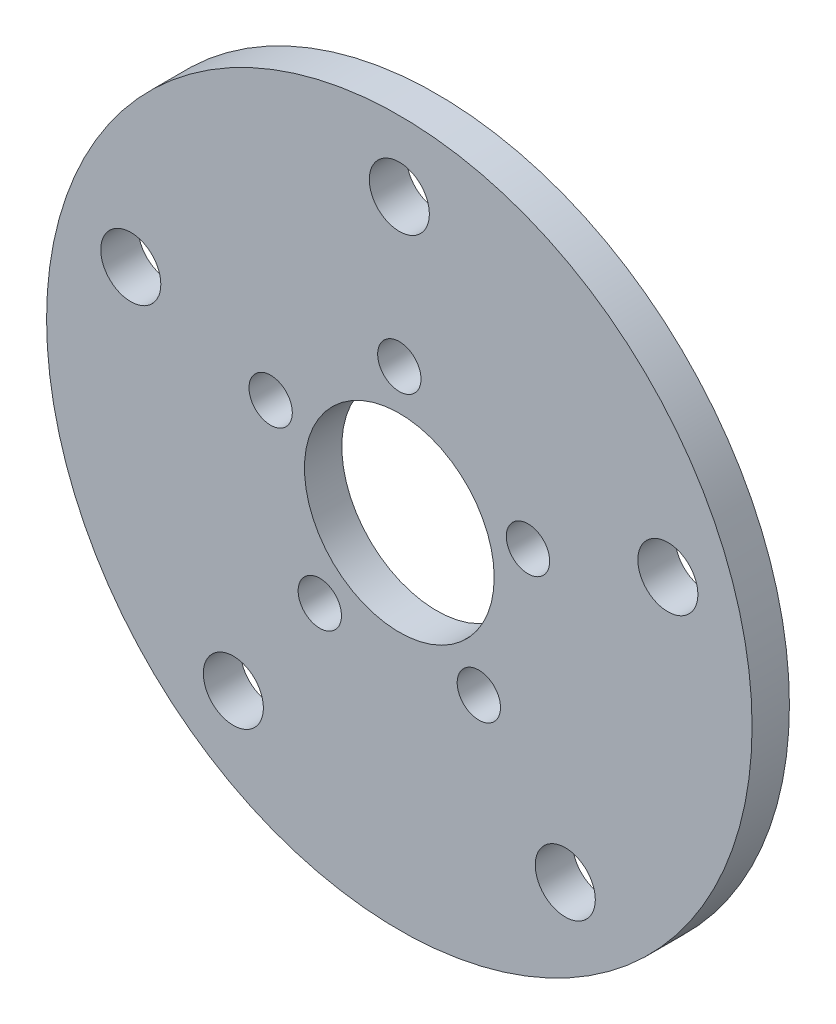
from build123d import *

# Parameters (mm, degrees)
SKETCH1_R           = 29.9847
SKETCH1_R_2         = 8.0645
SKETCH1_R_3         = 1.8415
SKETCH1_R_4         = 2.5527
BOSS_EXTRUDE1_DEPTH = 3.175


with BuildPart() as part:
    # Sketch1 → Boss-Extrude1 (new body)
    with BuildSketch(Plane.XY):
        Circle(SKETCH1_R)
        Circle(SKETCH1_R_2, mode=Mode.SUBTRACT)
        with Locations((0, 11.5)):
            Circle(SKETCH1_R_3, mode=Mode.SUBTRACT)
        with Locations((0, 24.000000006)):
            Circle(SKETCH1_R_4, mode=Mode.SUBTRACT)
        with Locations((10.937149937, 3.553695435)):
            Circle(SKETCH1_R_3, mode=Mode.SUBTRACT)
        with Locations((22.825356397, 7.416407867)):
            Circle(SKETCH1_R_4, mode=Mode.SUBTRACT)
        with Locations((6.759530401, -9.303695435)):
            Circle(SKETCH1_R_3, mode=Mode.SUBTRACT)
        with Locations((14.106846059, -19.41640787)):
            Circle(SKETCH1_R_4, mode=Mode.SUBTRACT)
        with Locations((-6.759530401, -9.303695435)):
            Circle(SKETCH1_R_3, mode=Mode.SUBTRACT)
        with Locations((-14.106846059, -19.41640787)):
            Circle(SKETCH1_R_4, mode=Mode.SUBTRACT)
        with Locations((-10.937149937, 3.553695435)):
            Circle(SKETCH1_R_3, mode=Mode.SUBTRACT)
        with Locations((-22.825356397, 7.416407867)):
            Circle(SKETCH1_R_4, mode=Mode.SUBTRACT)
    extrude(amount=BOSS_EXTRUDE1_DEPTH)


solid = part.part
